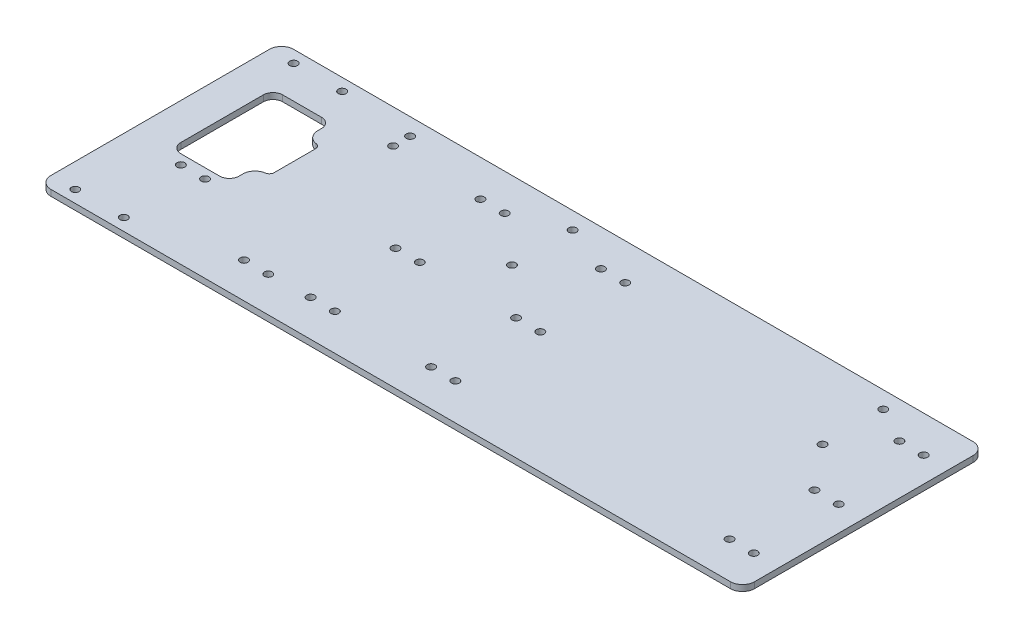
from build123d import *

# Parameters (mm, degrees)
SKETCH1_W           = 368.3
SKETCH1_H           = 127
SKETCH1_R           = 2.032
BOSS_EXTRUDE1_DEPTH = 3.175
FILLET1_R           = 5.08
FILLET3_R           = 6.35
FILLET4_R           = 2.54
FILLET5_R           = 6.35
CUT_EXTRUDE1_REACH  = 196.817
SKETCH2_R           = 2.032


with BuildPart() as part:
    # Sketch1 → Boss-Extrude1 (new body)
    with BuildSketch(Plane(origin=(0, 0, 0), x_dir=(1, 0, 0), z_dir=(0, 1, 0))):
        Rectangle(SKETCH1_W, SKETCH1_H)
        with Locations((-171.45, -57.15)):
            Circle(SKETCH1_R, mode=Mode.SUBTRACT)
        with Locations((-146.05, -57.15)):
            Circle(SKETCH1_R, mode=Mode.SUBTRACT)
        with Locations((-95.25, -45.0215)):
            Circle(SKETCH1_R, mode=Mode.SUBTRACT)
        with Locations((-82.55, -45.0215)):
            Circle(SKETCH1_R, mode=Mode.SUBTRACT)
        with Locations((-60.9677978, -44.45)):
            Circle(SKETCH1_R, mode=Mode.SUBTRACT)
        with Locations((-48.2677978, -44.45)):
            Circle(SKETCH1_R, mode=Mode.SUBTRACT)
        with Locations((-154.94, -18.415)):
            Circle(SKETCH1_R, mode=Mode.SUBTRACT)
        with Locations((-142.24, -18.415)):
            Circle(SKETCH1_R, mode=Mode.SUBTRACT)
        with Locations((2.1088604, -44.45)):
            Circle(SKETCH1_R, mode=Mode.SUBTRACT)
        with Locations((14.8088604, -44.45)):
            Circle(SKETCH1_R, mode=Mode.SUBTRACT)
        with Locations((158.3188604, -44.45)):
            Circle(SKETCH1_R, mode=Mode.SUBTRACT)
        with Locations((171.0188604, -44.45)):
            Circle(SKETCH1_R, mode=Mode.SUBTRACT)
        Polygon((-134.618428208, -13.335), (-165.098428208, -13.335), (-165.098428208, 40.005), (-134.618428208, 40.005), (-134.618428208, 26.67), (-126.998428208, 26.67), (-126.998428208, 0), (-134.618428208, 0), align=None, mode=Mode.SUBTRACT)
        with Locations((-60.9677978, 0)):
            Circle(SKETCH1_R, mode=Mode.SUBTRACT)
        with Locations((-48.2677978, 0)):
            Circle(SKETCH1_R, mode=Mode.SUBTRACT)
        with Locations((-171.45, 57.15)):
            Circle(SKETCH1_R, mode=Mode.SUBTRACT)
        with Locations((-146.05, 57.15)):
            Circle(SKETCH1_R, mode=Mode.SUBTRACT)
        with Locations((-60.9677978, 44.45)):
            Circle(SKETCH1_R, mode=Mode.SUBTRACT)
        with Locations((-48.2677978, 44.45)):
            Circle(SKETCH1_R, mode=Mode.SUBTRACT)
        with Locations((2.1088604, 0)):
            Circle(SKETCH1_R, mode=Mode.SUBTRACT)
        with Locations((14.8088604, 0)):
            Circle(SKETCH1_R, mode=Mode.SUBTRACT)
        with Locations((158.3188604, 0)):
            Circle(SKETCH1_R, mode=Mode.SUBTRACT)
        with Locations((171.0188604, 0)):
            Circle(SKETCH1_R, mode=Mode.SUBTRACT)
        with Locations((2.1088604, 44.45)):
            Circle(SKETCH1_R, mode=Mode.SUBTRACT)
        with Locations((14.8088604, 44.45)):
            Circle(SKETCH1_R, mode=Mode.SUBTRACT)
        with Locations((158.3188604, 44.45)):
            Circle(SKETCH1_R, mode=Mode.SUBTRACT)
        with Locations((171.0188604, 44.45)):
            Circle(SKETCH1_R, mode=Mode.SUBTRACT)
    extrude(amount=BOSS_EXTRUDE1_DEPTH)

    # Fillet1
    fillet1_edges = [part.edges().sort_by_distance(p)[0] for p in [
        (-134.618428208, 1.5875, 13.335),
        (-165.098428208, 1.5875, 13.335),
        (-165.098428208, 1.5875, -40.005),
        (-134.618428208, 1.5875, -40.005),
    ]]
    fillet(fillet1_edges, radius=FILLET1_R)

    # Fillet3
    fillet3_edges = [part.edges().sort_by_distance(p)[0] for p in [
        (184.15, 1.5875, 63.5),
        (184.15, 1.5875, -63.5),
        (-184.15, 1.5875, 63.5),
        (-184.15, 1.5875, -63.5),
    ]]
    fillet(fillet3_edges, radius=FILLET3_R)

    # Fillet4
    fillet4_edges = [part.edges().sort_by_distance(p)[0] for p in [
        (-126.998428208, 1.5875, 0),
        (-126.998428208, 1.5875, -26.67),
    ]]
    fillet(fillet4_edges, radius=FILLET4_R)

    # Fillet5
    fillet5_edges = [part.edges().sort_by_distance(p)[0] for p in [
        (-134.618428208, 1.5875, 0),
        (-134.618428208, 1.5875, -26.67),
    ]]
    fillet(fillet5_edges, radius=FILLET5_R)

    # Sketch2 → Cut-Extrude1 (cut, up to next)
    with BuildSketch(Plane(origin=(0, 3.175, 0), x_dir=(1, 0, 0), z_dir=(0, 1, 0)), mode=Mode.PRIVATE) as cut_extrude1_sk1:
        with Locations((139.7, 22.86)):
            Circle(SKETCH2_R)
    cut_extrude1_tool1 = extrude(cut_extrude1_sk1.sketch, amount=-CUT_EXTRUDE1_REACH, mode=Mode.PRIVATE) & part.part
    # Sketch2 → Cut-Extrude1 (cut, up to next)
    with BuildSketch(Plane(origin=(0, 3.175, 0), x_dir=(1, 0, 0), z_dir=(0, 1, 0)), mode=Mode.PRIVATE) as cut_extrude1_sk2:
        with Locations((139.7, 54.61)):
            Circle(SKETCH2_R)
    cut_extrude1_tool2 = extrude(cut_extrude1_sk2.sketch, amount=-CUT_EXTRUDE1_REACH, mode=Mode.PRIVATE) & part.part
    # Sketch2 → Cut-Extrude1 (cut, up to next)
    with BuildSketch(Plane(origin=(0, 3.175, 0), x_dir=(1, 0, 0), z_dir=(0, 1, 0)), mode=Mode.PRIVATE) as cut_extrude1_sk3:
        with Locations((-22.86, 54.61)):
            Circle(SKETCH2_R)
    cut_extrude1_tool3 = extrude(cut_extrude1_sk3.sketch, amount=-CUT_EXTRUDE1_REACH, mode=Mode.PRIVATE) & part.part
    # Sketch2 → Cut-Extrude1 (cut, up to next)
    with BuildSketch(Plane(origin=(0, 3.175, 0), x_dir=(1, 0, 0), z_dir=(0, 1, 0)), mode=Mode.PRIVATE) as cut_extrude1_sk4:
        with Locations((-22.86, 22.86)):
            Circle(SKETCH2_R)
    cut_extrude1_tool4 = extrude(cut_extrude1_sk4.sketch, amount=-CUT_EXTRUDE1_REACH, mode=Mode.PRIVATE) & part.part
    # Sketch2 → Cut-Extrude1 (cut, up to next)
    with BuildSketch(Plane(origin=(0, 3.175, 0), x_dir=(1, 0, 0), z_dir=(0, 1, 0)), mode=Mode.PRIVATE) as cut_extrude1_sk5:
        with Locations((-107.95, 54.61)):
            Circle(SKETCH2_R)
    cut_extrude1_tool5 = extrude(cut_extrude1_sk5.sketch, amount=-CUT_EXTRUDE1_REACH, mode=Mode.PRIVATE) & part.part
    # Sketch2 → Cut-Extrude1 (cut, up to next)
    with BuildSketch(Plane(origin=(0, 3.175, 0), x_dir=(1, 0, 0), z_dir=(0, 1, 0)), mode=Mode.PRIVATE) as cut_extrude1_sk6:
        with Locations((-107.95, 45.72)):
            Circle(SKETCH2_R)
    cut_extrude1_tool6 = extrude(cut_extrude1_sk6.sketch, amount=-CUT_EXTRUDE1_REACH, mode=Mode.PRIVATE) & part.part
    add(cut_extrude1_tool1.solids().sort_by_distance((139.7, 3.175, -22.86))[0], mode=Mode.SUBTRACT)
    add(cut_extrude1_tool2.solids().sort_by_distance((139.7, 3.175, -54.61))[0], mode=Mode.SUBTRACT)
    add(cut_extrude1_tool3.solids().sort_by_distance((-22.86, 3.175, -54.61))[0], mode=Mode.SUBTRACT)
    add(cut_extrude1_tool4.solids().sort_by_distance((-22.86, 3.175, -22.86))[0], mode=Mode.SUBTRACT)
    add(cut_extrude1_tool5.solids().sort_by_distance((-107.95, 3.175, -54.61))[0], mode=Mode.SUBTRACT)
    add(cut_extrude1_tool6.solids().sort_by_distance((-107.95, 3.175, -45.72))[0], mode=Mode.SUBTRACT)


solid = part.part
